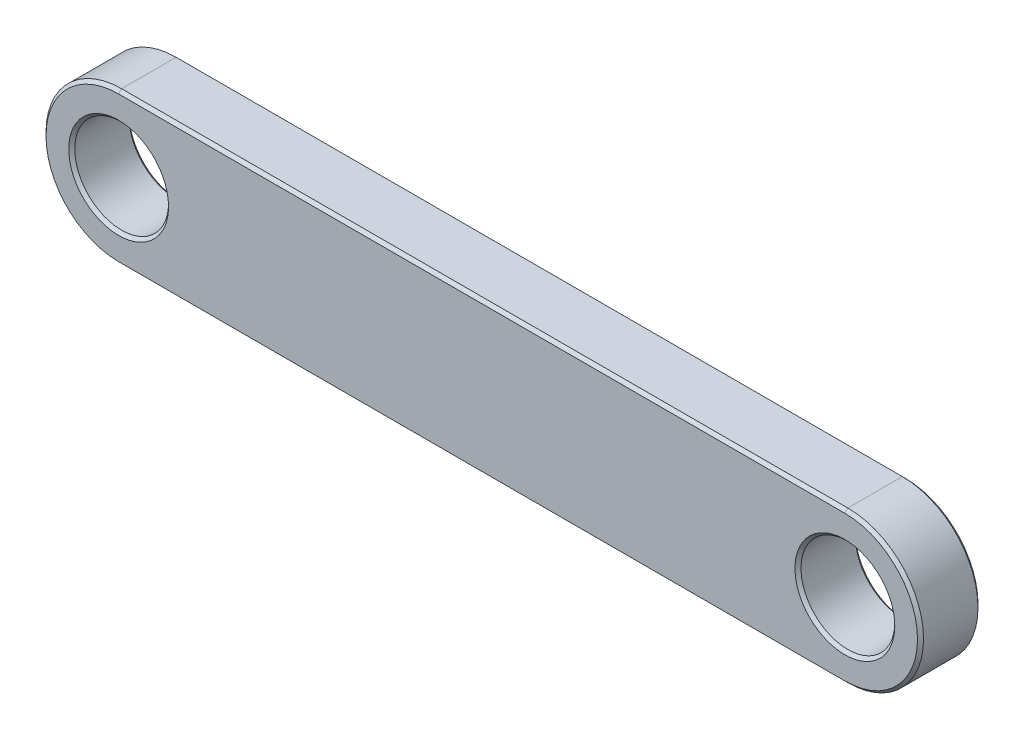
from build123d import *

# Parameters (mm, degrees)
SKETCH1_R           = 1.55
BOSS_EXTRUDE1_DEPTH = 2
CHAMFER1_SIZE       = 0.1


with BuildPart() as part:
    # Sketch1 → Boss-Extrude1 (new body)
    with BuildSketch(Plane.XY):
        with BuildLine():
            Line((12, -2.5), (-12, -2.5))
            ThreePointArc((-12, -2.5), (-14.5, 0), (-12, 2.5))
            Line((-12, 2.5), (12, 2.5))
            ThreePointArc((12, 2.5), (14.5, 0), (12, -2.5))
        make_face()
        with Locations((-12, 0)):
            Circle(SKETCH1_R, mode=Mode.SUBTRACT)
        with Locations((12, 0)):
            Circle(SKETCH1_R, mode=Mode.SUBTRACT)
    extrude(amount=BOSS_EXTRUDE1_DEPTH)

    # Chamfer1
    chamfer1_edges = [part.edges().sort_by_distance(p)[0] for p in [
        (10.45, 0, 0),
        (-13.55, 0, 0),
        (0, 2.5, 0),
        (-14.5, 0, 0),
        (0, -2.5, 0),
        (14.5, 0, 0),
        (10.45, 0, 2),
        (0, -2.5, 2),
        (-14.5, 0, 2),
        (0, 2.5, 2),
        (14.5, 0, 2),
        (-13.55, 0, 2),
    ]]
    chamfer(chamfer1_edges, length=CHAMFER1_SIZE)


solid = part.part
